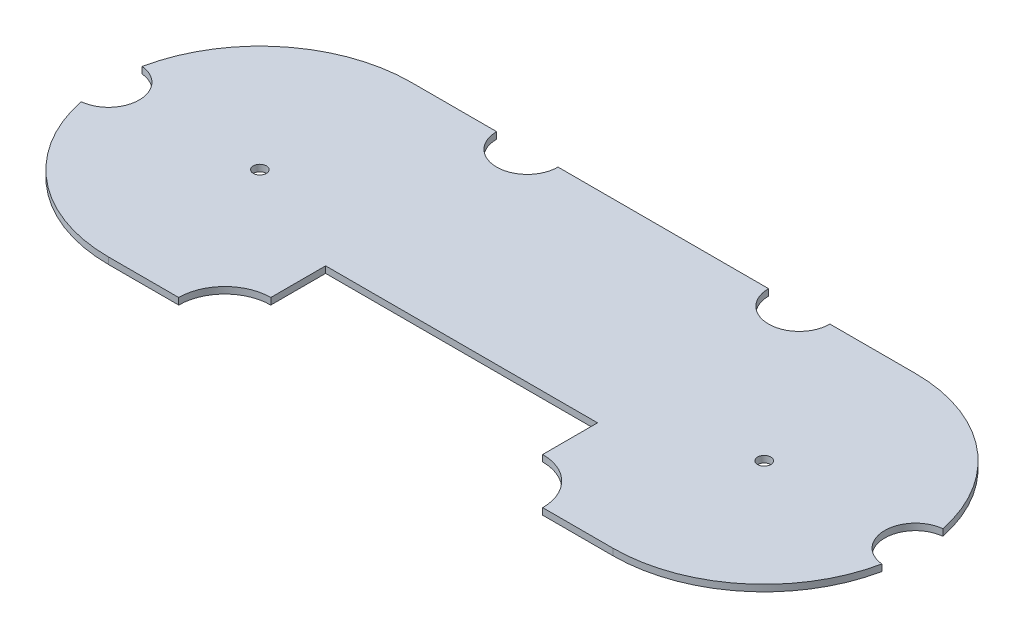
from build123d import *

# Parameters (mm, degrees)
SKETCH1_R           = 1.5
BOSS_EXTRUDE1_DEPTH = 1.5


with BuildPart() as part:
    # Sketch1 → Boss-Extrude1 (new body)
    with BuildSketch(Plane(origin=(0, 0, 0), x_dir=(1, 0, 0), z_dir=(0, 1, 0))):
        with BuildLine():
            Line((0, 34.5), (-24, 34.5))
            ThreePointArc((-24, 34.5), (-31, 27.5), (-38, 34.5))
            Line((-38, 34.5), (-57.5, 34.5))
            ThreePointArc((-57.5, 34.5), (-79.294448465, 26.744195933), (-91.289855072, 6.963884992))
            ThreePointArc((-91.289855072, 6.963884992), (-85, 0), (-91.289855072, -6.963884992))
            ThreePointArc((-91.289855072, -6.963884992), (-79.294448465, -26.744195933), (-57.5, -34.5))
            Line((-57.5, -34.5), (-41.5, -34.5))
            ThreePointArc((-41.5, -34.5), (-38.424621202, -27.075378798), (-31, -24))
            Line((-31, -24), (-31, -11.5))
            Line((-31, -11.5), (31, -11.5))
            Line((31, -11.5), (31, -24))
            ThreePointArc((31, -24), (38.424621202, -27.075378798), (41.5, -34.5))
            Line((41.5, -34.5), (57.5, -34.5))
            ThreePointArc((57.5, -34.5), (79.294448465, -26.744195933), (91.289855072, -6.963884992))
            ThreePointArc((91.289855072, -6.963884992), (85, 0), (91.289855072, 6.963884992))
            ThreePointArc((91.289855072, 6.963884992), (79.294448465, 26.744195933), (57.5, 34.5))
            Line((57.5, 34.5), (38, 34.5))
            ThreePointArc((38, 34.5), (31, 27.5), (24, 34.5))
            Line((24, 34.5), (0, 34.5))
        make_face()
        with Locations((-57.5, 0)):
            Circle(SKETCH1_R, mode=Mode.SUBTRACT)
        with Locations((57.5, 0)):
            Circle(SKETCH1_R, mode=Mode.SUBTRACT)
    extrude(amount=BOSS_EXTRUDE1_DEPTH)


solid = part.part
